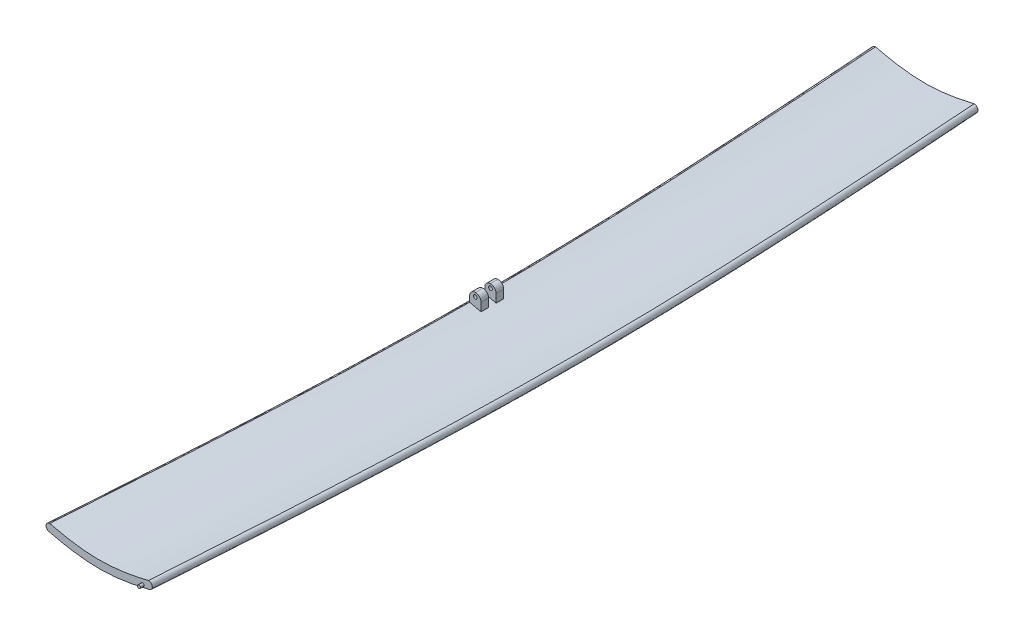
from build123d import *

# Parameters (mm, degrees)
SKETCH4_W            = 143.511953983
SKETCH4_H            = 18.108430665
SKETCH4_W_2          = 146.403726808
SKETCH4_H_2          = 23.968157225
CUT_EXTRUDE1_DEPTH   = 32.5
SKETCH3_R            = 2
BOSS_EXTRUDE1_DEPTH  = 550
SKETCH5_W            = 15
SKETCH5_H            = 10
BOSS_EXTRUDE2_DEPTH  = 20
CUT_EXTRUDE2_REACH   = 565.3
SKETCH6_R            = 2.5
FILLET1_R            = 7.5
FILLET1_OF_MIRROR1_R = 7.5


with BuildPart() as part:
    # Sweep2: sweep along a path in Sketch2
    with BuildLine() as sweep2_path:  # in the path sketch's own coordinates; laid on its plane below (add() does not lay a ready-made edge on the line's plane)
        add(Edge.make_bspline(
            [(-24.41476581, 550), (8.13825527, 84.470109879), (8.13825527, -84.470109879), (-24.41476581, -550)],
            knots=[0, 0, 0, 0, 1, 1, 1, 1], degree=3))
    # Sketch1 → Sweep2 (sweep)
    with BuildSketch(Plane.XY):
        with BuildLine():
            ThreePointArc((65, -5), (70, 0), (65, 5))
            add(Edge.make_bspline(
                [(-65, 5), (-16.485213686, -7.09609478), (16.485213686, -7.09609478), (65, 5)],
                knots=[0, 0, 0, 0, 1, 1, 1, 1], degree=3))
            ThreePointArc((-65, 5), (-70, 0), (-65, -5))
            add(Edge.make_bspline(
                [(-65, -5), (-16.485213686, -17.09609478), (16.485213686, -17.09609478), (65, -5)],
                knots=[0, 0, 0, 0, 1, 1, 1, 1], degree=3))
        make_face()
    sweep(path=Plane(origin=(0, 0, 0), x_dir=(1, 0, 0), z_dir=(0, 1, 0)) * sweep2_path.line)

    # Sketch4 → Cut-Extrude1 (cut, symmetric)
    with BuildSketch(Plane(origin=(0, 0, 0), x_dir=(1, 0, 0), z_dir=(0, 1, 0))):
        with Locations((-22.488272338, -554.171262171)):
            Rectangle(SKETCH4_W, SKETCH4_H)
        with Locations((-21.042385925, 557.101125451)):
            Rectangle(SKETCH4_W_2, SKETCH4_H_2)
    extrude(amount=CUT_EXTRUDE1_DEPTH, both=True, mode=Mode.SUBTRACT)

    # Sketch3 → Boss-Extrude1 (add, symmetric)
    with BuildSketch(Plane.XY):
        with Locations((33.317999856, -3.579245113)):
            Circle(SKETCH3_R)
    extrude(amount=BOSS_EXTRUDE1_DEPTH, both=True)

    # Sketch5 → Boss-Extrude2 (add)
    with BuildSketch(Plane(origin=(0, 0, 0), x_dir=(1, 0, 0), z_dir=(0, 1, 0))):
        with Locations((-57.5, 10)):
            Rectangle(SKETCH5_W, SKETCH5_H)
    boss_extrude2 = extrude(amount=BOSS_EXTRUDE2_DEPTH)

    # Sketch6 → Cut-Extrude2 (cut, up to next)
    with BuildSketch(Plane.XY.offset(-5), mode=Mode.PRIVATE) as cut_extrude2_sk1:
        with Locations((-57.5, 14.877458303)):
            Circle(SKETCH6_R)
    cut_extrude2_tool1 = extrude(cut_extrude2_sk1.sketch, amount=-CUT_EXTRUDE2_REACH, mode=Mode.PRIVATE) & part.part
    cut_extrude2 = cut_extrude2_tool1.solids().sort_by_distance((-57.5, 14.877458, -5))[0]
    add(cut_extrude2, mode=Mode.SUBTRACT)

    # Fillet1
    fillet1_edges = [part.edges().sort_by_distance(p)[0] for p in [
        (-50, 20, -10),
        (-65, 20, -10),
    ]]
    fillet(fillet1_edges, radius=FILLET1_R - 0.0001)  # a hair under: the kernel refuses the full size

    # Mirror1: Boss-Extrude2, Cut-Extrude2 across plane
    add(boss_extrude2.mirror(Plane.XY))
    add(cut_extrude2.mirror(Plane.XY), mode=Mode.SUBTRACT)

    # Fillet1 of Mirror1
    fillet1_of_mirror1_edges = [part.edges().sort_by_distance(p)[0] for p in [
        (-50, 20, 10),
        (-65, 20, 10),
    ]]
    fillet(fillet1_of_mirror1_edges, radius=FILLET1_OF_MIRROR1_R - 0.0001)  # a hair under: the kernel refuses the full size


solid = part.part
